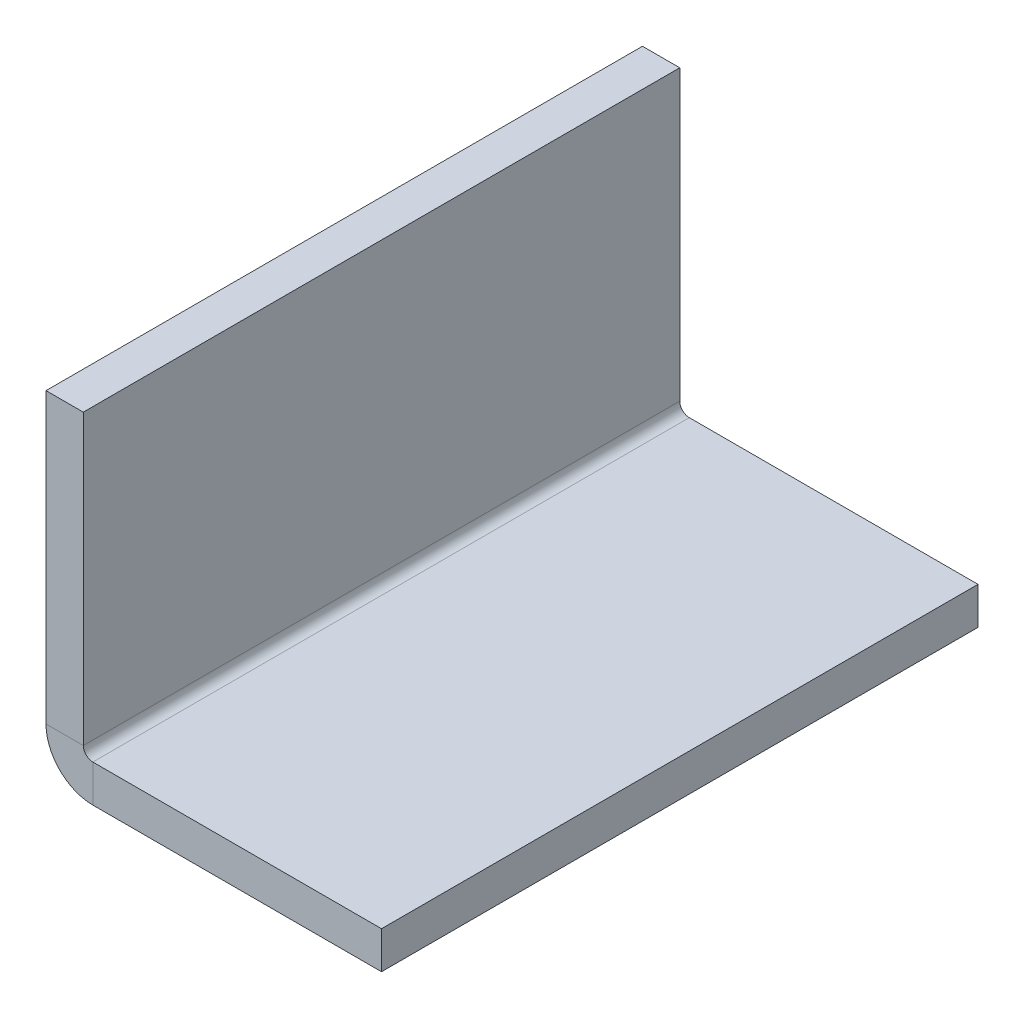
from build123d import *

# Parameters (mm, degrees)
BASE_FLANGE1_DEPTH = 25.4


# Sheet-metal steps are written as plain solids
with BuildPart() as part:
    # Sketch1 → Base-Flange1 (new, symmetric)
    with BuildSketch(Plane.XY):
        with BuildLine():
            Line((0, 25.4), (0, 0.8128))
            ThreePointArc((0, 0.8128), (0.238063608, 0.238063608), (0.8128, 0))
            Line((0.8128, 0), (25.4, 0))
            Line((25.4, 0), (25.4, -3.175))
            Line((25.4, -3.175), (0.8128, -3.175))
            ThreePointArc((0.8128, -3.175), (-2.007000422, -2.007000422), (-3.175, 0.8128))
            Line((-3.175, 0.8128), (-3.175, 25.4))
            Line((-3.175, 25.4), (0, 25.4))
        make_face()
    extrude(amount=BASE_FLANGE1_DEPTH, both=True)


solid = part.part
